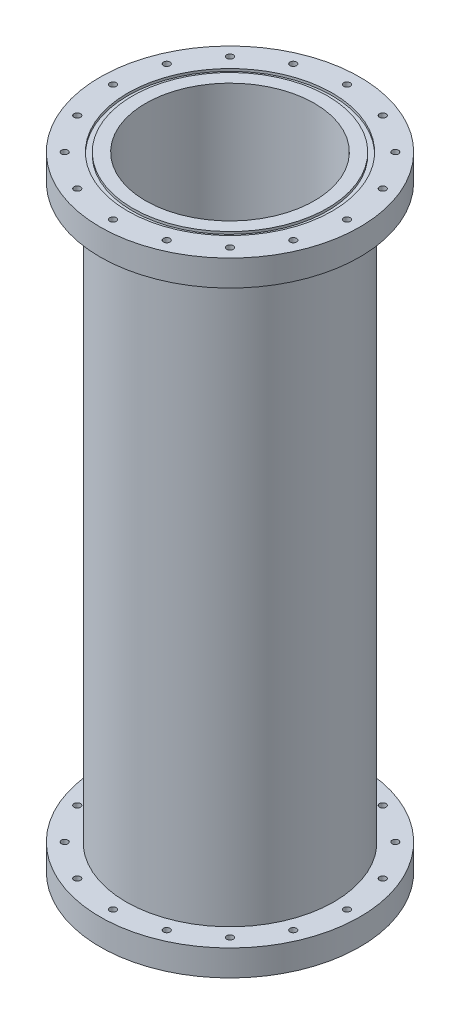
from build123d import *

# Parameters (mm, degrees)
SKETCH2_R               = 50.8
SKETCH2_R_2             = 41.275
BASE_CYLINDER_DEPTH     = 304.8
SKETCH3_R               = 63.5
SKETCH3_R_2             = 41.275
AFT_FLANGE_DEPTH        = 12.7
FORWARD_START           = -12.7
SKETCH4_R               = 63.5
SKETCH4_R_2             = 41.275
FORWARD_FLANGE_DEPTH    = 12.7
SKETCH6_R               = 50.00625
SKETCH6_R_2             = 47.625
O_RING_SLOT_1_DEPTH     = 1.190625
O_RING_START            = -1.190625
SKETCH7_R               = 50.00625
SKETCH7_R_2             = 47.625
O_RING_SLOT_2_DEPTH     = 1.190625
CUT_EXTRUDE4_DEPTH      = 318.753898481
CUT_EXTRUDE4_DEPTH_BACK = 318.753898481
SKETCH8_R               = 1.5875


with BuildPart() as part:
    # Sketch2 → Base Cylinder (new body)
    with BuildSketch(Plane(origin=(0, 0, 0), x_dir=(1, 0, 0), z_dir=(0, 1, 0))):
        Circle(SKETCH2_R)
        Circle(SKETCH2_R_2, mode=Mode.SUBTRACT)
    extrude(amount=BASE_CYLINDER_DEPTH)

    # Sketch3 → Aft Flange (add)
    with BuildSketch(Plane.XZ):
        Circle(SKETCH3_R)
        Circle(SKETCH3_R_2, mode=Mode.SUBTRACT)
    extrude(amount=-AFT_FLANGE_DEPTH)

    # Sketch4 → Forward Flange (add)
    with BuildSketch(Plane(origin=(0, 304.8, 0), x_dir=(1, 0, 0), z_dir=(0, 1, 0)).offset(FORWARD_START)):
        Circle(SKETCH4_R)
        Circle(SKETCH4_R_2, mode=Mode.SUBTRACT)
    extrude(amount=FORWARD_FLANGE_DEPTH)

    # Sketch6 → O-Ring Slot 1 (cut)
    with BuildSketch(Plane.XZ):
        Circle(SKETCH6_R)
        Circle(SKETCH6_R_2, mode=Mode.SUBTRACT)
    extrude(amount=-O_RING_SLOT_1_DEPTH, mode=Mode.SUBTRACT)

    # Sketch7 → O-Ring Slot 2 (cut)
    with BuildSketch(Plane(origin=(0, 304.8, 0), x_dir=(1, 0, 0), z_dir=(0, 1, 0)).offset(O_RING_START)):
        Circle(SKETCH7_R)
        Circle(SKETCH7_R_2, mode=Mode.SUBTRACT)
    extrude(amount=O_RING_SLOT_2_DEPTH, mode=Mode.SUBTRACT)

    # Sketch8 → Cut-Extrude4 (cut, two sides: drawn at the far end of the back side and taken through both)
    with BuildSketch(Plane.XZ.offset(-CUT_EXTRUDE4_DEPTH_BACK)):
        with Locations((-57.15, 0)):
            Circle(SKETCH8_R)
        with Locations((-52.799715283, 21.87035816)):
            Circle(SKETCH8_R)
        with Locations((-40.411152545, 40.411152545)):
            Circle(SKETCH8_R)
        with Locations((-21.87035816, 52.799715283)):
            Circle(SKETCH8_R)
        with Locations((0, 57.15)):
            Circle(SKETCH8_R)
        with Locations((21.87035816, 52.799715283)):
            Circle(SKETCH8_R)
        with Locations((40.411152545, 40.411152545)):
            Circle(SKETCH8_R)
        with Locations((52.799715283, 21.87035816)):
            Circle(SKETCH8_R)
        with Locations((57.15, 0)):
            Circle(SKETCH8_R)
        with Locations((52.799715283, -21.87035816)):
            Circle(SKETCH8_R)
        with Locations((40.411152545, -40.411152545)):
            Circle(SKETCH8_R)
        with Locations((21.87035816, -52.799715283)):
            Circle(SKETCH8_R)
        with Locations((0, -57.15)):
            Circle(SKETCH8_R)
        with Locations((-21.87035816, -52.799715283)):
            Circle(SKETCH8_R)
        with Locations((-40.411152545, -40.411152545)):
            Circle(SKETCH8_R)
        with Locations((-52.799715283, -21.87035816)):
            Circle(SKETCH8_R)
    extrude(amount=CUT_EXTRUDE4_DEPTH + CUT_EXTRUDE4_DEPTH_BACK, mode=Mode.SUBTRACT)


solid = part.part
